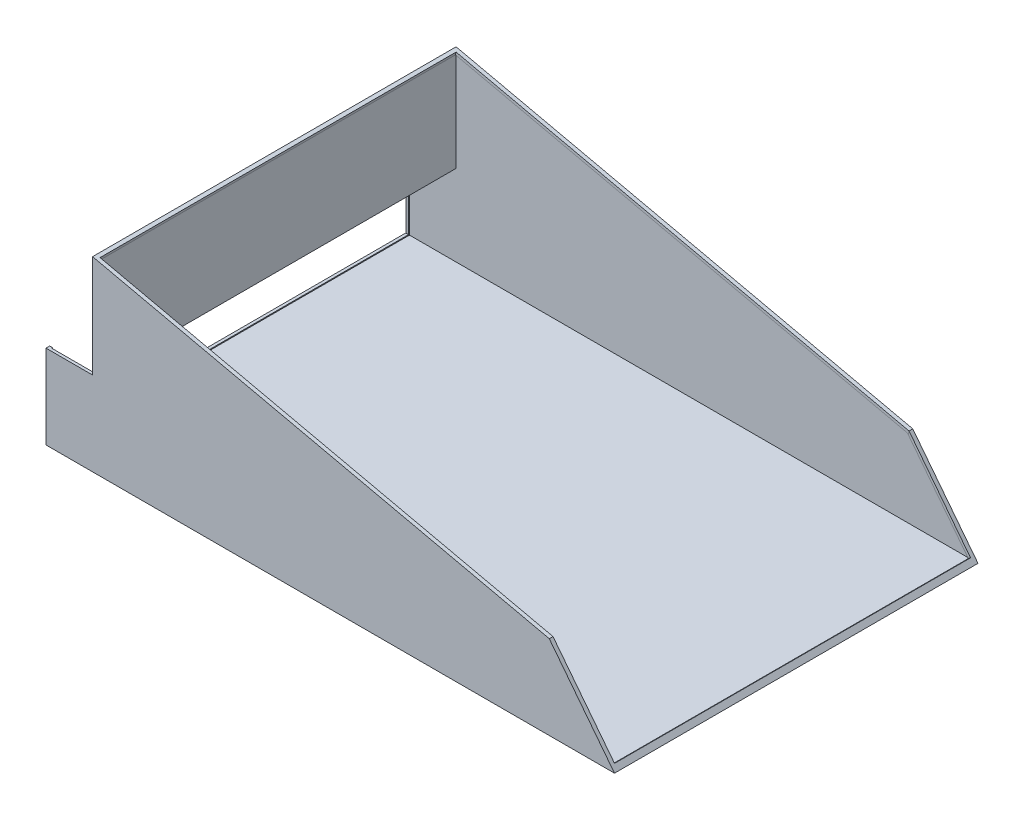
from build123d import *

# Parameters (mm, degrees)
BOSS_EXTRUDE1_DEPTH = 97.5
SHELL2_START        = -95.5
SHELL2_DEPTH        = 191
SHELL2_START_2      = -96
SHELL2_2_DEPTH      = 192


with BuildPart() as part:
    # Sketch2 → Boss-Extrude1 (new, symmetric)
    with BuildSketch(Plane.XY):
        Polygon((0, 100), (245, 45), (280, 0), (0, 0), (-25, 0), (-25, 45), (0, 45), align=None)
    extrude(amount=BOSS_EXTRUDE1_DEPTH, both=True)

    # Shell2: read off the stored shape, not the designer's step
    # Shell2 outline → Shell2 (cut)
    with BuildSketch(Plane.XY.offset(SHELL2_START)):
        Polygon((-25, 45), (-25, 2), (-23.5, 2), (-23.5, 1.5), (276.933040958, 1.5), (276.815971674, 1.650517651), (278, 2.571428571), (245, 45), (2, 99.551020408), (1.671442487, 98.08744603), (1.5, 98.125933119), (1.5, 45), align=None)
    extrude(amount=SHELL2_DEPTH, mode=Mode.SUBTRACT)

    # Shell2 2 outline → Shell2 2 (cut)
    with BuildSketch(Plane.XY.offset(SHELL2_START_2)):
        Polygon((-23.5, 45), (-23.5, 1.5), (276.933040958, 1.5), (244.146362645, 43.654300688), (1.5, 98.125933119), (1.5, 45), align=None)
    extrude(amount=SHELL2_2_DEPTH, mode=Mode.SUBTRACT)


solid = part.part
